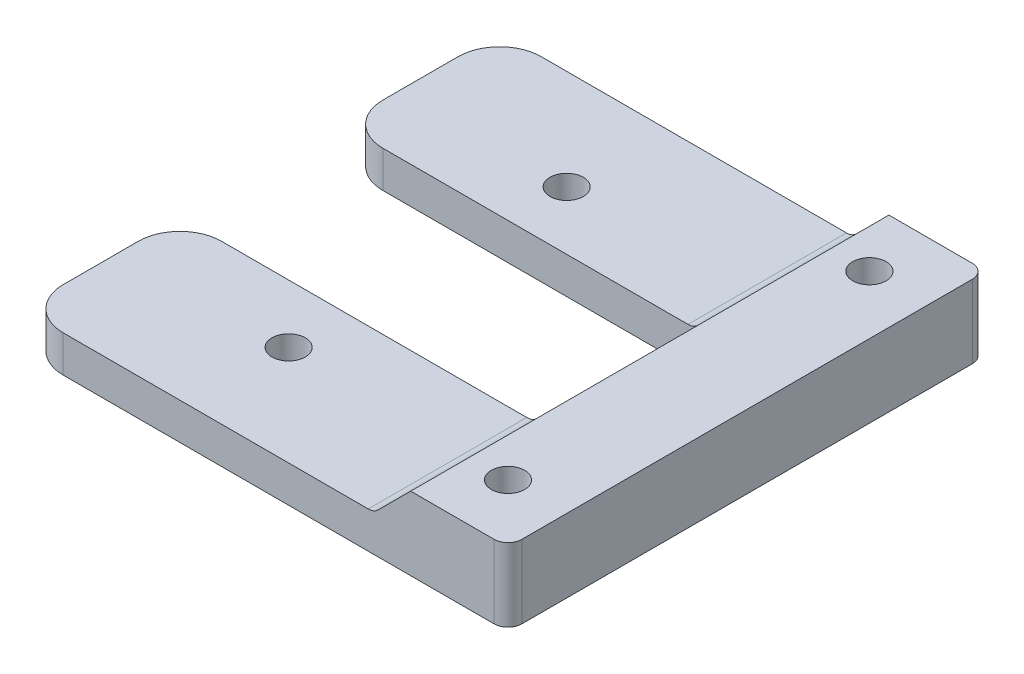
from build123d import *

# Parameters (mm, degrees)
SKETCH1_W           = 7
SKETCH1_H           = 2.635
BOSS_EXTRUDE1_DEPTH = 17.2
CUT_EXTRUDE1_REACH  = 41.352
SKETCH2_R           = 1.2
CUT_EXTRUDE2_REACH  = 41.087
SKETCH3_R           = 1.2
SKETCH3_W           = 28
SKETCH3_H           = 11.6
CHAMFER1_SIZE       = 2.635
FILLET2_R           = 1
FILLET3_R           = 3
FILLET4_R           = 1


with BuildPart() as part:
    # Sketch1 → Boss-Extrude1 (new, symmetric)
    with BuildSketch(Plane.XY):
        Polygon((0, -5.27), (0, -2.635), (-7, -2.635), (-35, -2.635), (-35, -5.27), align=None)
        with Locations((-3.5, -1.3175)):
            Rectangle(SKETCH1_W, SKETCH1_H)
    extrude(amount=BOSS_EXTRUDE1_DEPTH, both=True)

    # Sketch2 → Cut-Extrude1 (cut, up to next)
    with BuildSketch(Plane(origin=(0, 0, 0), x_dir=(1, 0, 0), z_dir=(0, 1, 0)), mode=Mode.PRIVATE) as cut_extrude1_sk1:
        with Locations(Location((-4.2, 13, 0), (0, 0, 270))):
            Circle(SKETCH2_R)
    cut_extrude1_tool1 = extrude(cut_extrude1_sk1.sketch, amount=-CUT_EXTRUDE1_REACH, mode=Mode.PRIVATE) & part.part
    # Sketch2 → Cut-Extrude1 (cut, up to next)
    with BuildSketch(Plane(origin=(0, 0, 0), x_dir=(1, 0, 0), z_dir=(0, 1, 0)), mode=Mode.PRIVATE) as cut_extrude1_sk2:
        with Locations(Location((-4.2, -13, 0), (0, 0, 270))):
            Circle(SKETCH2_R)
    cut_extrude1_tool2 = extrude(cut_extrude1_sk2.sketch, amount=-CUT_EXTRUDE1_REACH, mode=Mode.PRIVATE) & part.part
    add(cut_extrude1_tool1.solids().sort_by_distance((-4.2, 0, -13))[0], mode=Mode.SUBTRACT)
    add(cut_extrude1_tool2.solids().sort_by_distance((-4.2, 0, 13))[0], mode=Mode.SUBTRACT)

    # Sketch3 → Cut-Extrude2 (cut, up to next)
    with BuildSketch(Plane(origin=(0, -2.635, 0), x_dir=(1, 0, 0), z_dir=(0, 1, 0)), mode=Mode.PRIVATE) as cut_extrude2_sk1:
        with Locations(Location((-22.979761, 10, 0), (0, 0, 180))):
            Circle(SKETCH3_R)
    cut_extrude2_tool1 = extrude(cut_extrude2_sk1.sketch, amount=-CUT_EXTRUDE2_REACH, mode=Mode.PRIVATE) & part.part
    # Sketch3 → Cut-Extrude2 (cut, up to next)
    with BuildSketch(Plane(origin=(0, -2.635, 0), x_dir=(1, 0, 0), z_dir=(0, 1, 0)), mode=Mode.PRIVATE) as cut_extrude2_sk2:
        with Locations(Location((-22.979761, -10, 0), (0, 0, 180))):
            Circle(SKETCH3_R)
    cut_extrude2_tool2 = extrude(cut_extrude2_sk2.sketch, amount=-CUT_EXTRUDE2_REACH, mode=Mode.PRIVATE) & part.part
    # Sketch3 → Cut-Extrude2 (cut, up to next)
    with BuildSketch(Plane(origin=(0, -2.635, 0), x_dir=(1, 0, 0), z_dir=(0, 1, 0)), mode=Mode.PRIVATE) as cut_extrude2_sk3:
        with Locations((-21, 0)):
            Rectangle(SKETCH3_W, SKETCH3_H)
    cut_extrude2_tool3 = extrude(cut_extrude2_sk3.sketch, amount=-CUT_EXTRUDE2_REACH, mode=Mode.PRIVATE) & part.part
    add(cut_extrude2_tool1.solids().sort_by_distance((-22.979761, -2.635, -10))[0], mode=Mode.SUBTRACT)
    add(cut_extrude2_tool2.solids().sort_by_distance((-22.979761, -2.635, 10))[0], mode=Mode.SUBTRACT)
    add(cut_extrude2_tool3.solids().sort_by_distance((-21, -2.635, 0))[0], mode=Mode.SUBTRACT)

    # Chamfer1
    # the kernel refuses this chamfer: 2.635 mm, written as the material it adds along each edge
    with BuildSketch(Plane(origin=(-7, -2.635, 5.8), x_dir=(0.027495876610586358, 0.9996219169112968, 0), z_dir=(0, 0, 1))) as chamfer1_piece_1_section:
        Polygon((CHAMFER1_SIZE * 0.999621916911, CHAMFER1_SIZE * 0.0274958766106), (-CHAMFER1_SIZE * 0.0274958766106, CHAMFER1_SIZE * 0.999621916911), (0, 0), align=None)
    chamfer1_piece_1 = extrude(amount=11.4, mode=Mode.PRIVATE)
    chamfer1_piece_1 = split(chamfer1_piece_1, bisect_by=Plane(origin=(-7.870614947, 0, 11.5), z_dir=(0, -1, 0)), keep=Keep.TOP, mode=Mode.PRIVATE)
    add(chamfer1_piece_1)
    with BuildSketch(Plane(origin=(-7, -2.635, -17.2), x_dir=(0.027495876610586358, 0.9996219169112968, 0), z_dir=(0, 0, 1))) as chamfer1_piece_2_section:
        Polygon((CHAMFER1_SIZE * 0.999621916911, CHAMFER1_SIZE * 0.0274958766106), (-CHAMFER1_SIZE * 0.0274958766106, CHAMFER1_SIZE * 0.999621916911), (0, 0), align=None)
    chamfer1_piece_2 = extrude(amount=11.4, mode=Mode.PRIVATE)
    chamfer1_piece_2 = split(chamfer1_piece_2, bisect_by=Plane(origin=(-7.870614947, 0, -11.5), z_dir=(0, -1, 0)), keep=Keep.TOP, mode=Mode.PRIVATE)
    add(chamfer1_piece_2)

    # Fillet2
    fillet2_edges = [part.edges().sort_by_distance(p)[0] for p in [
        (-7, -2.635, -5.8),
        (-7, -2.635, 5.8),
        (-9.635, -2.635, 11.5),
        (-9.635, -2.635, -11.5),
    ]]
    fillet(fillet2_edges, radius=FILLET2_R)

    # Fillet3
    fillet3_edges = [part.edges().sort_by_distance(p)[0] for p in [
        (-35, -3.9525, -17.2),
        (-35, -3.9525, 17.2),
        (-35, -3.9525, 5.8),
        (-35, -3.9525, -5.8),
    ]]
    fillet(fillet3_edges, radius=FILLET3_R)

    # Fillet4
    fillet4_edges = [part.edges().sort_by_distance(p)[0] for p in [
        (0, -2.635, 17.2),
        (0, -2.635, -17.2),
    ]]
    fillet(fillet4_edges, radius=FILLET4_R)


solid = part.part
